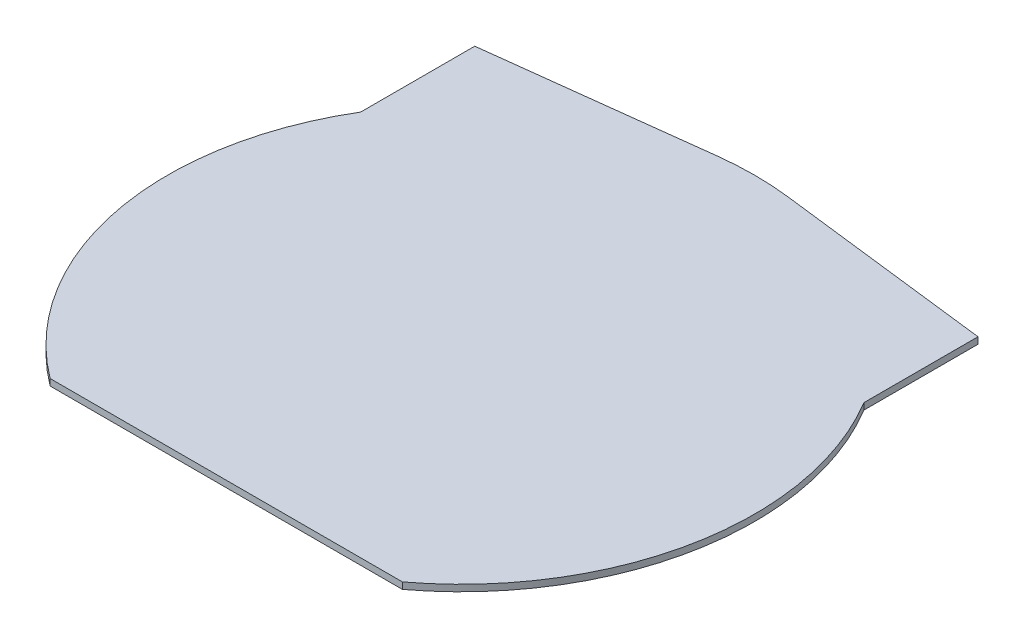
from build123d import *

# Parameters (mm, degrees)
BOSS_EXTRUDE2_DEPTH = 1
MOTOR_SPACING_W     = 154.291365686
MOTOR_SPACING_H     = 35
BOSS_EXTRUDE6_DEPTH = 2
FILLET4_START       = -1
FILLET4_DEPTH       = 2


with BuildPart() as part:
    # Top_lay → Boss-Extrude2 (new, symmetric)
    with BuildSketch(Plane(origin=(0, 0, 0), x_dir=(1, 0, 0), z_dir=(0, 1, 0))):
        with BuildLine():
            Line((-54, -72), (54, -72))
            ThreePointArc((54, -72), (0, 90), (-54, -72))
        make_face()
    extrude(amount=BOSS_EXTRUDE2_DEPTH, both=True)

    # Motor_Spacing → Boss-Extrude6 (add)
    with BuildSketch(Plane(origin=(0, 1, 0), x_dir=(1, 0, 0), z_dir=(0, 1, 0))):
        with Locations((0, 63.828780022)):
            Rectangle(MOTOR_SPACING_W, MOTOR_SPACING_H)
    extrude(amount=-BOSS_EXTRUDE6_DEPTH)

    # Fillet4: read off the stored shape, not the designer's step
    # Fillet4 outline → Fillet4 (add)
    with BuildSketch(Plane(origin=(0, 0, 0), x_dir=(1, 0, 0), z_dir=(0, 1, 0)).offset(FILLET4_START)):
        with BuildLine():
            ThreePointArc((-38.543865143, 81.328780022), (-25.0207268, 86.452086328), (-10.85161032, 89.34339681))
            ThreePointArc((-10.85161032, 89.34339681), (-43.997531602, 85.326865697), (-77.145682843, 81.328780022))
            Line((-77.145682843, 81.328780022), (-38.543865143, 81.328780022))
        make_face()
        with BuildLine():
            ThreePointArc((77.145682843, 81.328780022), (43.997531602, 85.326865697), (10.85161032, 89.34339681))
            ThreePointArc((10.85161032, 89.34339681), (25.0207268, 86.452086328), (38.543865143, 81.328780022))
            Line((38.543865143, 81.328780022), (77.145682843, 81.328780022))
        make_face()
    extrude(amount=FILLET4_DEPTH)


solid = part.part
